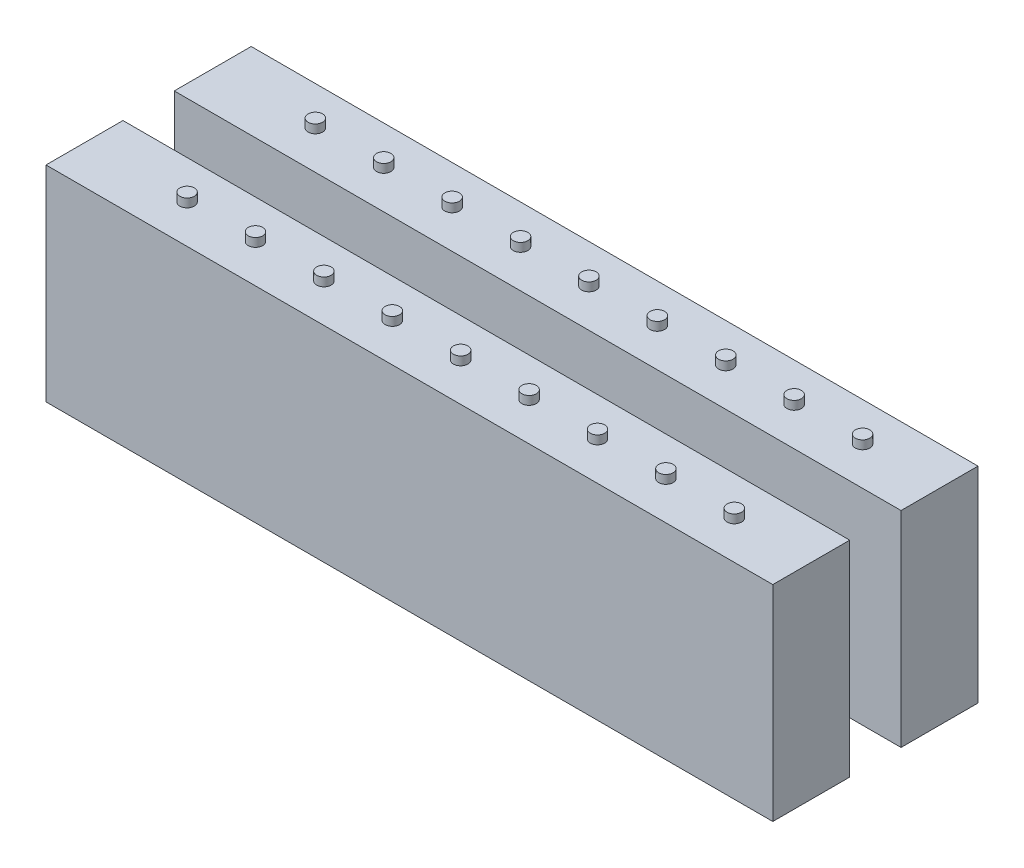
from build123d import *

# Parameters (mm, degrees)
SKETCH1_W                = 215.9
SKETCH1_H                = 63.5
BOSS_EXTRUDE1_DEPTH      = 22.86
CUT_EXTRUDE1_START       = -2.54
CUT_EXTRUDE1_OUTLINE_W   = 215.9
CUT_EXTRUDE1_OUTLINE_H   = 22.86
CUT_EXTRUDE1_OUTLINE_R   = 2.15
CUT_EXTRUDE1_DEPTH       = 2.54
CUT_EXTRUDE1_START_2     = -63.5
CUT_EXTRUDE1_2_OUTLINE_W = 215.9
CUT_EXTRUDE1_2_OUTLINE_H = 22.86
CUT_EXTRUDE1_2_DEPTH     = 60.96
CUT_EXTRUDE1_3_OUTLINE_R = 2.15
CUT_EXTRUDE1_3_DEPTH     = 2.54


# Read off the part's stored shape, not the designer's step: Cut-Extrude1
with BuildPart() as part:
    # Sketch1 → Boss-Extrude1 (new body)
    with BuildSketch(Plane.XY.offset(169.285605486)):
        with Locations((64.933768792, 136.406845874)):
            Rectangle(SKETCH1_W, SKETCH1_H)
    extrude(amount=-BOSS_EXTRUDE1_DEPTH)

    # Cut-Extrude1 outline → Cut-Extrude1 (cut)
    with BuildSketch(Plane(origin=(0, 168.156845874, 0), x_dir=(1, 0, 0), z_dir=(0, 1, 0)).offset(CUT_EXTRUDE1_START)):
        with Locations((64.933768792, -157.855605486)):
            Rectangle(CUT_EXTRUDE1_OUTLINE_W, CUT_EXTRUDE1_OUTLINE_H)
        with Locations((-12.536231208, -157.855605486)):
            Circle(CUT_EXTRUDE1_OUTLINE_R, mode=Mode.SUBTRACT)
        with Locations((7.783768792, -157.855605486)):
            Circle(CUT_EXTRUDE1_OUTLINE_R, mode=Mode.SUBTRACT)
        with Locations((28.103768792, -157.855605486)):
            Circle(CUT_EXTRUDE1_OUTLINE_R, mode=Mode.SUBTRACT)
        with Locations((48.423768792, -157.855605486)):
            Circle(CUT_EXTRUDE1_OUTLINE_R, mode=Mode.SUBTRACT)
        with Locations((68.743768792, -157.855605486)):
            Circle(CUT_EXTRUDE1_OUTLINE_R, mode=Mode.SUBTRACT)
        with Locations((89.063768792, -157.855605486)):
            Circle(CUT_EXTRUDE1_OUTLINE_R, mode=Mode.SUBTRACT)
        with Locations((109.383768792, -157.855605486)):
            Circle(CUT_EXTRUDE1_OUTLINE_R, mode=Mode.SUBTRACT)
        with Locations((129.703768792, -157.855605486)):
            Circle(CUT_EXTRUDE1_OUTLINE_R, mode=Mode.SUBTRACT)
        with Locations((150.023768792, -157.855605486)):
            Circle(CUT_EXTRUDE1_OUTLINE_R, mode=Mode.SUBTRACT)
    extrude(amount=CUT_EXTRUDE1_DEPTH, mode=Mode.SUBTRACT)


with BuildPart() as body_2:
    # Cut-Extrude1 2 outline → Cut-Extrude1 2 (new body)
    with BuildSketch(Plane(origin=(0, 168.156845874, 0), x_dir=(1, 0, 0), z_dir=(0, 1, 0)).offset(CUT_EXTRUDE1_START_2)):
        with Locations((64.933768792, -195.955605486)):
            Rectangle(CUT_EXTRUDE1_2_OUTLINE_W, CUT_EXTRUDE1_2_OUTLINE_H)
    extrude(amount=CUT_EXTRUDE1_2_DEPTH)

    # Cut-Extrude1 3 outline → Cut-Extrude1 3 (add)
    with BuildSketch(Plane(origin=(0, 168.156845874, 0), x_dir=(1, 0, 0), z_dir=(0, 1, 0)).offset(CUT_EXTRUDE1_START)):
        with Locations((-12.536231208, -195.955605486)):
            Circle(CUT_EXTRUDE1_3_OUTLINE_R)
        with Locations((7.783768792, -195.955605486)):
            Circle(CUT_EXTRUDE1_3_OUTLINE_R)
        with Locations((28.103768792, -195.955605486)):
            Circle(CUT_EXTRUDE1_3_OUTLINE_R)
        with Locations((48.423768792, -195.955605486)):
            Circle(CUT_EXTRUDE1_3_OUTLINE_R)
        with Locations((68.743768792, -195.955605486)):
            Circle(CUT_EXTRUDE1_3_OUTLINE_R)
        with Locations((89.063768792, -195.955605486)):
            Circle(CUT_EXTRUDE1_3_OUTLINE_R)
        with Locations((109.383768792, -195.955605486)):
            Circle(CUT_EXTRUDE1_3_OUTLINE_R)
        with Locations((129.703768792, -195.955605486)):
            Circle(CUT_EXTRUDE1_3_OUTLINE_R)
        with Locations((150.023768792, -195.955605486)):
            Circle(CUT_EXTRUDE1_3_OUTLINE_R)
    extrude(amount=CUT_EXTRUDE1_3_DEPTH)


solid = Compound([part.part, body_2.part])
